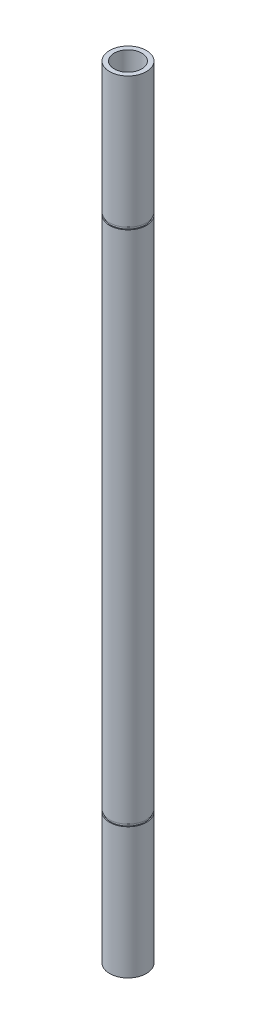
from build123d import *


with BuildPart() as part:
    # Sketch1 → Revolve2 (revolve)
    with BuildSketch(Plane.XY):
        Polygon((-3, 85), (-4, 85), (-4, 56.5), (-3.8, 56.5), (-3.8, 56), (-4, 56), (-4, -56), (-3.8, -56), (-3.8, -56.5), (-4, -56.5), (-4, -85), (-3, -85), align=None)
    revolve(axis=Axis((0, 64.302267184, 0), (0, -1, 0)))


solid = part.part
